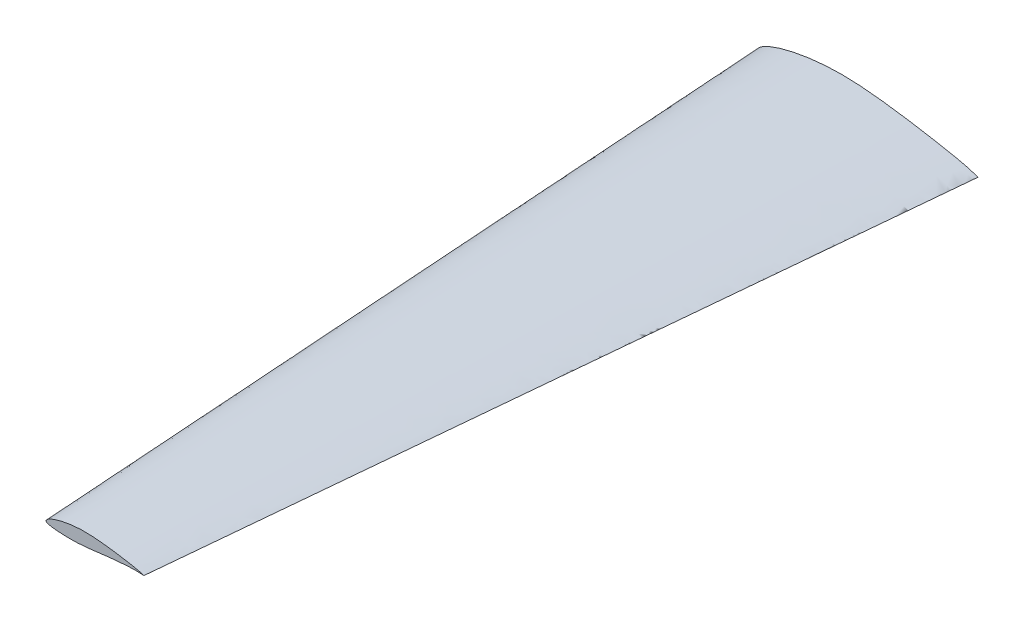
from build123d import *

# Parameters (mm, degrees)
SKETCH7_W           = 226.371566509
SKETCH7_H           = 151.802109306
BOSS_EXTRUDE1_DEPTH = 10


with BuildPart() as part:
    # Loft5: read off the stored shape, not the designer's step
    # Loft5: loft between two sections, ruled curve by curve
    loft5_from = [
        Edge.make_bspline([(-1162.904300009, -36.010271297, 0), (-1162.920517006, -36.204727761, 0), (-1162.958285904, -36.83330098, 0), (-1162.939504228, -37.728420673, 0), (-1162.758066469, -38.839996669, 0), (-1162.437156177, -39.758459861, 0), (-1161.926466184, -40.789168347, 0), (-1161.11663317, -42.102999913, 0), (-1160.040831731, -43.426132347, 0), (-1158.083169263, -45.541040295, 0), (-1156.230194309, -47.197487119, 0), (-1151.947137497, -50.590883757, 0), (-1148.313917837, -52.891126765, 0), (-1139.615268468, -57.713401364, 0), (-1133.224469615, -60.497679762, 0), (-1117.506605307, -66.507052185, 0), (-1106.79674918, -69.719281906, 0), (-1083.772537747, -75.697492401, 0), (-1070.147982922, -78.56872391, 0), (-1041.379274586, -83.838822216, 0), (-1024.931310699, -86.319425873, 0), (-990.692971942, -90.864457146, 0), (-971.603180748, -93.003387014, 0), (-932.324743639, -96.831827235, 0), (-910.836949285, -98.57655303, 0), (-867.03305602, -101.588733601, 0), (-843.417892861, -102.891593828, 0), (-795.646920767, -104.990564101, 0), (-770.191990263, -105.801112323, 0), (-719.053076037, -106.820965663, 0), (-692.070077807, -107.018325104, 0), (-638.089774283, -106.682418977, 0), (-609.794232769, -106.104249086, 0), (-553.350969113, -104.149119241, 0), (-523.906737864, -102.692951447, 0), (-465.269139857, -98.941505818, 0), (-434.781940137, -96.532158064, 0), (-374.054372749, -91.026795514, 0), (-342.522869997, -87.790684075, 0), (-279.873455726, -81.110104571, 0), (-247.464881019, -77.522247978, 0), (-183.486970195, -70.417913792, 0), (-150.626853079, -66.759083688, 0), (-86.201694341, -59.754235319, 0), (-53.345595565, -56.268462655, 0), (10.584682404, -49.761290492, 0), (42.950412474, -46.605003831, 0), (105.396969886, -40.927535562, 0), (136.769888646, -38.2760967, 0), (196.709894193, -33.685951703, 0), (226.569789575, -31.624724678, 0), (282.968833425, -28.238142766, 0), (310.802717243, -26.800443348, 0), (362.69475755, -24.694580941, 0), (388.045353539, -23.920608722, 0), (434.408953615, -23.019257081, 0), (456.730129024, -22.805971179, 0), (496.927894664, -23.002108203, 0), (516.060151014, -23.3253515, 0), (548.621162877, -24.187245718, 0), (563.505640748, -24.708525161, 0), (589.809000037, -26.332130571, 0), (601.996348163, -27.285401619, 0), (616.720254095, -28.276633639, 0), (622.242609223, -28.657087243, 0), (634.304255827, -30.519590137, 0), (637.767352205, -31.054355071, 0), (636.531359391, -30.485560222, 0), (632.598653888, -29.439590789, 0), (622.527298587, -26.560558642, 0), (617.919324193, -24.735780473, 0), (605.456552962, -20.152383052, 0), (595.564232462, -16.797599667, 0), (575.158949053, -10.257713147, 0), (563.585645313, -6.854092115, 0), (538.447932921, -0.128975114, 0), (523.522197451, 3.404598666, 0), (492.185268142, 10.516946682, 0), (474.516835379, 14.321637568, 0), (437.777607592, 21.99595553, 0), (417.423060215, 26.098780404, 0), (375.669090055, 34.314799084, 0), (352.992529576, 38.656195411, 0), (306.890358802, 47.283169543, 0), (282.184783564, 51.790498544, 0), (232.364695015, 60.680736685, 0), (205.969420458, 65.278165566, 0), (153.127527158, 74.226782037, 0), (125.398401007, 78.782215442, 0), (70.229214351, 87.555329183, 0), (41.505020999, 91.966511487, 0), (-15.287218447, 100.31694012, 0), (-44.641223467, 104.436946687, 0), (-102.361433622, 112.063594938, 0), (-132.015598337, 115.73582676, 0), (-189.996150467, 122.349479497, 0), (-219.612607884, 125.438767403, 0), (-277.210978204, 130.71516103, 0), (-306.485112567, 133.029035132, 0), (-363.18831297, 136.536762427, 0), (-391.911975766, 137.830631343, 0), (-447.376355624, 139.265879129, 0), (-475.414229911, 139.466899337, 0), (-529.3841213, 138.699551849, 0), (-556.614697566, 137.745994937, 0), (-608.881245275, 134.778356997, 0), (-635.215542093, 132.727142384, 0), (-685.532147177, 127.81492211, 0), (-710.810406809, 124.865157822, 0), (-758.764990157, 118.378962244, 0), (-782.733574385, 114.71028862, 0), (-827.816748447, 106.888055313, 0), (-850.219846889, 102.5666909, 0), (-891.958163011, 93.612393307, 0), (-912.576165162, 88.770155099, 0), (-950.535502968, 78.914803457, 0), (-969.153214753, 73.653090142, 0), (-1002.933901237, 63.107755101, 0), (-1019.365257137, 57.533207681, 0), (-1048.593877169, 46.536988765, 0), (-1062.649934572, 40.778274946, 0), (-1087.016019689, 29.529598441, 0), (-1098.573122767, 23.655031878, 0), (-1117.845408678, 12.374847986, 0), (-1126.79574539, 6.517259984, 0), (-1140.894965262, -4.460954103, 0), (-1147.2332913, -10.121614706, 0), (-1153.07844749, -16.951657421, 0), (-1154.245922458, -18.389832202, 0), (-1156.967788293, -21.962221407, 0), (-1159.10086606, -25.291265921, 0), (-1161.256385882, -29.791293488, 0), (-1162.09993706, -31.987755387, 0), (-1162.700367537, -34.418990668, 0), (-1162.855648208, -35.42689219, 0), (-1162.904300009, -36.010271297, 0)], [0, 0, 0, 0, 0.000158858, 0.000512164, 0.000723803, 0.00107711, 0.001302238, 0.001655545, 0.002333877, 0.002687183, 0.00400362, 0.004356926, 0.007144152, 0.007497458, 0.012464278, 0.012817584, 0.021220552, 0.021573858, 0.032223796, 0.032577102, 0.045442075, 0.045795381, 0.060764694, 0.061118, 0.078005039, 0.078358345, 0.096953849, 0.097307155, 0.117385453, 0.117738759, 0.139053693, 0.139407, 0.161796849, 0.162150155, 0.185501716, 0.185855022, 0.210106345, 0.210459652, 0.235623072, 0.235976379, 0.261883226, 0.262236532, 0.288515909, 0.288869215, 0.31512997, 0.315483276, 0.341318171, 0.341671477, 0.366662093, 0.367015399, 0.390736041, 0.391089347, 0.413133747, 0.413487053, 0.433466039, 0.433819346, 0.451372334, 0.45172564, 0.466514145, 0.466867452, 0.478637876, 0.478991182, 0.487516787, 0.487870093, 0.492959922, 0.493313228, 0.49479887, 0.495152176, 0.496579124, 0.496932431, 0.501575489, 0.501928795, 0.509106502, 0.509459808, 0.518845117, 0.519198423, 0.530915273, 0.53126858, 0.545345843, 0.545699149, 0.561928754, 0.56228206, 0.580423299, 0.580776605, 0.600566162, 0.600919468, 0.622080968, 0.622434275, 0.644662984, 0.64501629, 0.66802863, 0.668381936, 0.691867948, 0.692221254, 0.715901904, 0.71625521, 0.739850827, 0.740204134, 0.76346205, 0.763815356, 0.786571668, 0.786924974, 0.809097378, 0.809450685, 0.830976381, 0.831329688, 0.852176229, 0.852529536, 0.872590541, 0.872943847, 0.892023758, 0.892377064, 0.910288183, 0.910641489, 0.927216198, 0.927569504, 0.942648105, 0.943001411, 0.956449628, 0.956802934, 0.968485862, 0.968839169, 0.978697266, 0.979050572, 0.987061378, 0.987414684, 0.993595691, 0.993948997, 0.994753897, 0.995107204, 0.997609477, 0.997962784, 0.999170113, 0.999523419, 1, 1, 1, 1], 3),
    ]
    loft5_to = [
        Edge.make_bspline([(-751.127407138, -47.646450923, 6200), (-751.141425132, -47.731701038, 6200), (-751.181479745, -48.007349219, 6200), (-751.212003011, -48.400212637, 6200), (-751.205936582, -48.902236553, 6200), (-751.149350948, -49.329465992, 6200), (-750.994737817, -49.811820136, 6200), (-750.69310225, -50.431282994, 6200), (-750.256246487, -51.045969648, 6200), (-749.416488377, -52.010755452, 6200), (-748.611427802, -52.761584437, 6200), (-746.73086348, -54.287926497, 6200), (-745.127778881, -55.315521698, 6200), (-741.271616254, -57.451893168, 6200), (-738.436071417, -58.674361062, 6200), (-731.452005928, -61.28610243, 6200), (-726.694952759, -62.667060725, 6200), (-716.466679165, -65.209751508, 6200), (-710.416790484, -66.415088778, 6200), (-697.644342596, -68.600756178, 6200), (-690.344479221, -69.611682633, 6200), (-675.151371616, -71.436270257, 6200), (-666.682488131, -72.277308383, 6200), (-649.260178746, -73.751704674, 6200), (-639.731015486, -74.402627498, 6200), (-620.308326956, -75.486802895, 6200), (-609.839170905, -75.928604398, 6200), (-588.664210242, -76.583675373, 6200), (-577.382832209, -76.796294591, 6200), (-554.722067026, -76.953786876, 6200), (-542.767268644, -76.886108019, 6200), (-518.855535363, -76.427358696, 6200), (-506.323726288, -76.008756046, 6200), (-481.330177816, -74.818526637, 6200), (-468.29453437, -74.00430387, 6200), (-442.339202583, -72.005445654, 6200), (-428.847066353, -70.762228889, 6200), (-401.976193921, -67.971675754, 6200), (-388.026457908, -66.353929852, 6200), (-360.311756195, -63.025470298, 6200), (-345.975801609, -61.244463522, 6200), (-317.675438659, -57.71760724, 6200), (-303.140030242, -55.901194166, 6200), (-274.64121352, -52.413546609, 6200), (-260.106661837, -50.672935607, 6200), (-231.824260001, -47.407455683, 6200), (-217.505056961, -45.814966276, 6200), (-189.875157788, -42.924178108, 6200), (-175.992823604, -41.560556741, 6200), (-149.466929055, -39.165391295, 6200), (-136.251337684, -38.071782211, 6200), (-111.286803427, -36.230090033, 6200), (-98.965105274, -35.424161848, 6200), (-75.989967226, -34.175170143, 6200), (-64.764072704, -33.677660304, 6200), (-44.229229766, -32.995122157, 6200), (-34.343056361, -32.763382861, 6200), (-16.538258232, -32.601555003, 6200), (-8.05769346, -32.626935881, 6200), (6.385837086, -32.809037312, 6200), (12.97290427, -32.944349073, 6200), (24.591679793, -33.488374438, 6200), (30.030060425, -33.838730721, 6200), (36.68993115, -34.204579094, 6200), (39.034036697, -34.311166181, 6200), (44.073344639, -34.987900882, 6200), (45.927247352, -35.265215584, 6200), (46.468035896, -35.238418769, 6200), (45.024469602, -34.862364293, 6200), (40.234120624, -33.603433343, 6200), (38.07946271, -32.80994025, 6200), (32.655380595, -30.878800399, 6200), (28.285312988, -29.453284575, 6200), (19.172424622, -26.650341903, 6200), (14.018896651, -25.199296771, 6200), (2.859749783, -22.352634015, 6200), (-3.76900719, -20.869046961, 6200), (-17.695751063, -17.895906333, 6200), (-25.54564439, -16.31180281, 6200), (-41.864822426, -13.125457918, 6200), (-50.905693723, -11.426531929, 6200), (-69.451327564, -8.030998734, 6200), (-79.522670229, -6.240572572, 6200), (-99.996716228, -2.689257219, 6200), (-110.967871892, -0.837558428, 6200), (-133.090718616, 2.80806841, 6200), (-144.810978199, 4.689733268, 6200), (-168.272744519, 8.34388716, 6200), (-180.583631154, 10.199264824, 6200), (-205.075357182, 13.762168612, 6200), (-217.826185503, 15.548053992, 6200), (-243.034336985, 18.91501172, 6200), (-256.06240455, 20.56872842, 6200), (-281.677276649, 23.610796864, 6200), (-294.835635649, 25.064984745, 6200), (-320.559817263, 27.657899897, 6200), (-333.698000986, 28.854926004, 6200), (-359.244905506, 30.859896083, 6200), (-372.226857308, 31.716874049, 6200), (-397.366811805, 32.947010661, 6200), (-410.098991872, 33.356641239, 6200), (-434.678287394, 33.677542349, 6200), (-447.100446372, 33.607926016, 6200), (-471.005220483, 32.96359131, 6200), (-483.063233533, 32.387754572, 6200), (-506.20108055, 30.778982811, 6200), (-517.855832223, 29.721818889, 6200), (-540.118788289, 27.261468573, 6200), (-551.300593789, 25.811809028, 6200), (-572.508172184, 22.667090059, 6200), (-583.105791709, 20.906726386, 6200), (-603.034084244, 17.188201501, 6200), (-612.934669547, 15.148363328, 6200), (-631.375133313, 10.948584903, 6200), (-640.48228119, 8.689126763, 6200), (-657.244351257, 4.114131131, 6200), (-665.463564111, 1.681731434, 6200), (-680.37191932, -3.171909182, 6200), (-687.621764667, -5.728454315, 6200), (-700.513224708, -10.751709364, 6200), (-706.711546364, -13.373193996, 6200), (-717.45173122, -18.47336174, 6200), (-722.545778818, -21.12763347, 6200), (-731.03727156, -26.204324501, 6200), (-734.982039139, -28.830667966, 6200), (-741.194715598, -33.73310934, 6200), (-743.997220988, -36.25019478, 6200), (-746.590147531, -39.272983414, 6200), (-747.109292328, -39.908239355, 6200), (-748.322705006, -41.483173753, 6200), (-749.284306226, -42.948163639, 6200), (-750.272684648, -44.924056037, 6200), (-750.675662256, -45.886522389, 6200), (-750.987134729, -46.949220976, 6200), (-751.085352453, -47.390696319, 6200), (-751.127407138, -47.646450923, 6200)], [0, 0, 0, 0, 0.000158858, 0.000512164, 0.000723803, 0.00107711, 0.001302238, 0.001655545, 0.002333877, 0.002687183, 0.00400362, 0.004356926, 0.007144152, 0.007497458, 0.012464278, 0.012817584, 0.021220552, 0.021573858, 0.032223796, 0.032577102, 0.045442075, 0.045795381, 0.060764694, 0.061118, 0.078005039, 0.078358345, 0.096953849, 0.097307155, 0.117385453, 0.117738759, 0.139053693, 0.139407, 0.161796849, 0.162150155, 0.185501716, 0.185855022, 0.210106345, 0.210459652, 0.235623072, 0.235976379, 0.261883226, 0.262236532, 0.288515909, 0.288869215, 0.31512997, 0.315483276, 0.341318171, 0.341671477, 0.366662093, 0.367015399, 0.390736041, 0.391089347, 0.413133747, 0.413487053, 0.433466039, 0.433819346, 0.451372334, 0.45172564, 0.466514145, 0.466867452, 0.478637876, 0.478991182, 0.487516787, 0.487870093, 0.492959922, 0.493313228, 0.49479887, 0.495152176, 0.496579124, 0.496932431, 0.501575489, 0.501928795, 0.509106502, 0.509459808, 0.518845117, 0.519198423, 0.530915273, 0.53126858, 0.545345843, 0.545699149, 0.561928754, 0.56228206, 0.580423299, 0.580776605, 0.600566162, 0.600919468, 0.622080968, 0.622434275, 0.644662984, 0.64501629, 0.66802863, 0.668381936, 0.691867948, 0.692221254, 0.715901904, 0.71625521, 0.739850827, 0.740204134, 0.76346205, 0.763815356, 0.786571668, 0.786924974, 0.809097378, 0.809450685, 0.830976381, 0.831329688, 0.852176229, 0.852529536, 0.872590541, 0.872943847, 0.892023758, 0.892377064, 0.910288183, 0.910641489, 0.927216198, 0.927569504, 0.942648105, 0.943001411, 0.956449628, 0.956802934, 0.968485862, 0.968839169, 0.978697266, 0.979050572, 0.987061378, 0.987414684, 0.993595691, 0.993948997, 0.994753897, 0.995107204, 0.997609477, 0.997962784, 0.999170113, 0.999523419, 1, 1, 1, 1], 3),
    ]
    loft5 = Solid(Shell([*[Face.make_surface_from_curves(loft5_from[k], loft5_to[k]) for k in range(1)], Face(Wire(loft5_from)), Face(Wire(loft5_to))]))
    add(loft5)

    # Sketch7 → Boss-Extrude1 (add)
    with BuildSketch(Plane(origin=(0, 0, 0), x_dir=(-1, 0, 0), z_dir=(0, 0, -1))):
        with Locations((491.847907021, 24.970484801)):
            Rectangle(SKETCH7_W, SKETCH7_H)
    extrude(amount=BOSS_EXTRUDE1_DEPTH)


solid = part.part
